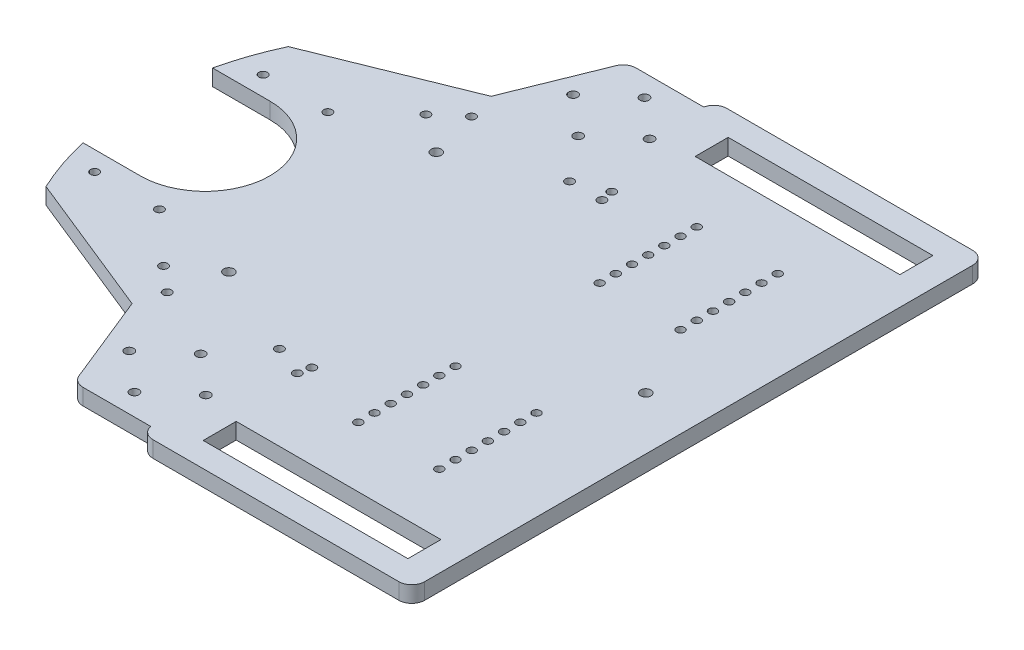
from build123d import *

# Parameters (mm, degrees)
BOSS_EXTRUDE1_DEPTH    = 6.35
SKETCH2_R              = 1.5875
SKETCH2_W              = 80.264
SKETCH2_H              = 12.954
CUT_EXTRUDE1_DEPTH     = 162.484606465
SKETCH7_R              = 2.032
CUT_EXTRUDE4_DEPTH     = 162.484606465
SKETCH8_R              = 1.651
CUT_EXTRUDE5_DEPTH     = 162.484606465
CUT_EXTRUDE6_DEPTH     = 160.416662013
SKETCH10_R             = 1.651
CUT_EXTRUDE7_DEPTH     = 160.416662013
SKETCH11_W             = 225
SKETCH11_H             = 6.35
BOSS_EXTRUDE2_DEPTH    = 8
FILLET2_R              = 5.08
SKETCH15_W             = 29.985408059
SKETCH15_H             = 4.069721463
CUT_EXTRUDE8_DEPTH     = 160.416662013
CUT_EXTRUDE9_START     = -6.35
CUT_EXTRUDE9_OUTLINE_R = 1.775
CUT_EXTRUDE9_DEPTH     = 6.35


# Read off the part's stored shape, not the designer's step: Cut-Extrude9
with BuildPart() as part:
    # Sketch1 → Boss-Extrude1 (new body)
    with BuildSketch(Plane(origin=(0, 0, 0), x_dir=(1, 0, 0), z_dir=(0, 1, 0))):
        with BuildLine():
            Line((-3.175, 112.5), (95.25, 112.5))
            Line((95.25, 112.5), (95.25, -112.5))
            Line((95.25, -112.5), (-3.175, -112.5))
            ThreePointArc((-3.175, -112.5), (-115.675, 0), (-3.175, 112.5))
        make_face()
    extrude(amount=-BOSS_EXTRUDE1_DEPTH)

    # Sketch2 → Cut-Extrude1 (cut, through all)
    with BuildSketch(Plane(origin=(0, 0, 0), x_dir=(1, 0, 0), z_dir=(0, 1, 0))):
        with Locations(Location((36.144045702, -66.3448, 0), (0, 0, 270))):
            Circle(SKETCH2_R)
        with Locations(Location((36.144045702, -59.9948, 0), (0, 0, 270))):
            Circle(SKETCH2_R)
        with Locations(Location((36.144045702, -53.6448, 0), (0, 0, 270))):
            Circle(SKETCH2_R)
        with Locations(Location((36.144045702, -47.2948, 0), (0, 0, 270))):
            Circle(SKETCH2_R)
        with Locations(Location((36.144045702, -40.9448, 0), (0, 0, 270))):
            Circle(SKETCH2_R)
        with Locations(Location((36.144045702, -34.5948, 0), (0, 0, 270))):
            Circle(SKETCH2_R)
        with Locations(Location((36.144045702, -28.2448, 0), (0, 0, 270))):
            Circle(SKETCH2_R)
        with Locations(Location((67.894045702, -66.3448, 0), (0, 0, 270))):
            Circle(SKETCH2_R)
        with Locations(Location((67.894045702, -59.9948, 0), (0, 0, 270))):
            Circle(SKETCH2_R)
        with Locations(Location((67.894045702, -53.6448, 0), (0, 0, 270))):
            Circle(SKETCH2_R)
        with Locations(Location((67.894045702, -47.2948, 0), (0, 0, 270))):
            Circle(SKETCH2_R)
        with Locations(Location((67.894045702, -40.9448, 0), (0, 0, 270))):
            Circle(SKETCH2_R)
        with Locations(Location((67.894045702, -34.5948, 0), (0, 0, 270))):
            Circle(SKETCH2_R)
        with Locations(Location((67.894045702, -28.2448, 0), (0, 0, 270))):
            Circle(SKETCH2_R)
        with Locations(Location((36.144045702, 66.3448, 0), (0, 0, 270))):
            Circle(SKETCH2_R)
        with Locations(Location((36.144045702, 59.9948, 0), (0, 0, 270))):
            Circle(SKETCH2_R)
        with Locations(Location((36.144045702, 53.6448, 0), (0, 0, 270))):
            Circle(SKETCH2_R)
        with Locations(Location((36.144045702, 47.2948, 0), (0, 0, 270))):
            Circle(SKETCH2_R)
        with Locations(Location((36.144045702, 40.9448, 0), (0, 0, 270))):
            Circle(SKETCH2_R)
        with Locations(Location((36.144045702, 34.5948, 0), (0, 0, 270))):
            Circle(SKETCH2_R)
        with Locations(Location((36.144045702, 28.2448, 0), (0, 0, 270))):
            Circle(SKETCH2_R)
        with Locations(Location((67.894045702, 66.3448, 0), (0, 0, 270))):
            Circle(SKETCH2_R)
        with Locations(Location((67.894045702, 59.9948, 0), (0, 0, 270))):
            Circle(SKETCH2_R)
        with Locations(Location((67.894045702, 53.6448, 0), (0, 0, 270))):
            Circle(SKETCH2_R)
        with Locations(Location((67.894045702, 47.2948, 0), (0, 0, 270))):
            Circle(SKETCH2_R)
        with Locations(Location((67.894045702, 40.9448, 0), (0, 0, 270))):
            Circle(SKETCH2_R)
        with Locations(Location((67.894045702, 34.5948, 0), (0, 0, 270))):
            Circle(SKETCH2_R)
        with Locations(Location((67.894045702, 28.2448, 0), (0, 0, 270))):
            Circle(SKETCH2_R)
        with Locations((52.019045702, -96.4438)):
            Rectangle(SKETCH2_W, SKETCH2_H)
        with Locations((52.019045702, 96.4438)):
            Rectangle(SKETCH2_W, SKETCH2_H)
    extrude(amount=-CUT_EXTRUDE1_DEPTH, mode=Mode.SUBTRACT)

    # Sketch7 → Cut-Extrude4 (cut, through all)
    with BuildSketch(Plane(origin=(0, 0, 0), x_dir=(1, 0, 0), z_dir=(0, 1, 0))):
        with Locations(Location((82.511862056, 0, 0), (0, 0, 270))):
            Circle(SKETCH7_R)
        with Locations(Location((-40.297137944, 40.64, 0), (0, 0, 270))):
            Circle(SKETCH7_R)
        with Locations(Location((-40.297137944, -40.64, 0), (0, 0, 270))):
            Circle(SKETCH7_R)
    extrude(amount=-CUT_EXTRUDE4_DEPTH, mode=Mode.SUBTRACT)

    # Sketch8 → Cut-Extrude5 (cut, through all)
    with BuildSketch(Plane(origin=(0, 0, 0), x_dir=(1, 0, 0), z_dir=(0, 1, 0))):
        with Locations(Location((-100.5586, 33.02, 0), (0, 0, 270))):
            Circle(SKETCH8_R)
        with Locations(Location((-100.5586, -33.02, 0), (0, 0, 270))):
            Circle(SKETCH8_R)
        with Locations(Location((-75.1586, 33.02, 0), (0, 0, 270))):
            Circle(SKETCH8_R)
        with Locations(Location((-75.1586, -33.02, 0), (0, 0, 270))):
            Circle(SKETCH8_R)
        with BuildLine():
            Line((-90.2716, 25.4), (-229.776686608, 25.4))
            Line((-229.776686608, 25.4), (-229.776686608, -25.4))
            Line((-229.776686608, -25.4), (-90.2716, -25.4))
            ThreePointArc((-90.2716, -25.4), (-64.8716, 0), (-90.2716, 25.4))
        make_face()
    extrude(amount=-CUT_EXTRUDE5_DEPTH, mode=Mode.SUBTRACT)

    # Sketch9 → Cut-Extrude6 (cut, through all)
    with BuildSketch(Plane(origin=(0, 0, 0), x_dir=(1, 0, 0), z_dir=(0, 1, 0))):
        Polygon((-105.15131959, 47.508738596), (-48.53191541, 70.384462776), (-12.279886537, 160.111382848), (-19.546794421, 160.111382848), (-135.640402248, 160.111382848), (-135.640402248, 47.508738596), align=None)
        Polygon((-105.15131959, -47.508738596), (-48.53191541, -70.384462776), (-12.279886537, -160.111382848), (-135.640402248, -160.111382848), (-135.640402248, -47.508738596), align=None)
    extrude(amount=-CUT_EXTRUDE6_DEPTH, mode=Mode.SUBTRACT)

    # Sketch10 → Cut-Extrude7 (cut, through all)
    with BuildSketch(Plane(origin=(0, 0, 0), x_dir=(1, 0, 0), z_dir=(0, 1, 0))):
        with Locations(Location((-55.150916162, 51.425007473, 0), (0, 0, 270))):
            Circle(SKETCH10_R)
        with Locations(Location((-45.493760399, 59.672997687, 0), (0, 0, 270))):
            Circle(SKETCH10_R)
        with Locations(Location((-4.266941588, 56.871109398, 0), (0, 0, 270))):
            Circle(SKETCH10_R)
        with Locations(Location((7.508293365, 61.628613135, 0), (0, 0, 270))):
            Circle(SKETCH10_R)
        with Locations(Location((8.433058412, -56.871109398, 0), (0, 0, 270))):
            Circle(SKETCH10_R)
        with Locations(Location((8.433058412, 56.871109398, 0), (0, 0, 270))):
            Circle(SKETCH10_R)
        with Locations(Location((-55.150916162, -51.425007473, 0), (0, 0, 270))):
            Circle(SKETCH10_R)
        with Locations(Location((-45.493760399, -59.672997687, 0), (0, 0, 270))):
            Circle(SKETCH10_R)
        with Locations(Location((-4.266941588, -56.871109398, 0), (0, 0, 270))):
            Circle(SKETCH10_R)
        with Locations(Location((7.508293365, -61.628613135, 0), (0, 0, 270))):
            Circle(SKETCH10_R)
    extrude(amount=-CUT_EXTRUDE7_DEPTH, mode=Mode.SUBTRACT)

    # Sketch11 → Boss-Extrude2 (add)
    with BuildSketch(Plane(origin=(95.25, 0, 0), x_dir=(0, 0, -1), z_dir=(1, 0, 0))):
        with Locations((0, -3.175)):
            Rectangle(SKETCH11_W, SKETCH11_H)
    extrude(amount=BOSS_EXTRUDE2_DEPTH)

    # Fillet2
    fillet2_edges = [part.edges().sort_by_distance(p)[0] for p in [
        (103.25, -3.175, -112.5),
        (103.25, -3.175, 112.5),
    ]]
    fillet(fillet2_edges, radius=FILLET2_R)

    # Sketch15 → Cut-Extrude8 (cut, through all)
    with BuildSketch(Plane(origin=(0, 0, 0), x_dir=(1, 0, 0), z_dir=(0, 1, 0))):
        with Locations((-18.16770403, -110.465139268)):
            Rectangle(SKETCH15_W, SKETCH15_H)
        with Locations((-18.16770403, 110.465139268)):
            Rectangle(SKETCH15_W, SKETCH15_H)
    extrude(amount=-CUT_EXTRUDE8_DEPTH, mode=Mode.SUBTRACT)

    # Cut-Extrude9 outline → Cut-Extrude9 (cut)
    with BuildSketch(Plane(origin=(0, 0, 0), x_dir=(1, 0, 0), z_dir=(0, 1, 0)).offset(CUT_EXTRUDE9_START)):
        with BuildLine():
            Line((-3.175, 112.5), (-3.175, 108.430278537))
            ThreePointArc((-3.175, 108.430278537), (-1.411607293, 111.353104052), (1.803527622, 112.5))
            Line((1.803527622, 112.5), (-3.175, 112.5))
        make_face()
        with BuildLine():
            ThreePointArc((-34.443998775, 105.253280031), (-32.574604743, 107.561789405), (-29.733904794, 108.430278537))
            Line((-29.733904794, 108.430278537), (-33.160408059, 108.430278537))
            Line((-33.160408059, 108.430278537), (-34.443998775, 105.253280031))
        make_face()
        with BuildLine():
            Line((-33.160408059, -108.430278537), (-29.733904794, -108.430278537))
            ThreePointArc((-29.733904794, -108.430278537), (-32.574604743, -107.561789405), (-34.443998775, -105.253280031))
            Line((-34.443998775, -105.253280031), (-33.160408059, -108.430278537))
        make_face()
        with BuildLine():
            ThreePointArc((1.803527622, -112.5), (-1.411607293, -111.353104052), (-3.175, -108.430278537))
            Line((-3.175, -108.430278537), (-3.175, -112.5))
            Line((-3.175, -112.5), (1.803527622, -112.5))
        make_face()
        with Locations((-33, -87)):
            Circle(CUT_EXTRUDE9_OUTLINE_R)
        with Locations((-18, -100)):
            Circle(CUT_EXTRUDE9_OUTLINE_R)
        with Locations((-18, -74)):
            Circle(CUT_EXTRUDE9_OUTLINE_R)
        with Locations((-3, -87)):
            Circle(CUT_EXTRUDE9_OUTLINE_R)
        with Locations((-33, 87)):
            Circle(CUT_EXTRUDE9_OUTLINE_R)
        with Locations((-18, 100)):
            Circle(CUT_EXTRUDE9_OUTLINE_R)
        with Locations((-18, 74)):
            Circle(CUT_EXTRUDE9_OUTLINE_R)
        with Locations((-3, 87)):
            Circle(CUT_EXTRUDE9_OUTLINE_R)
    extrude(amount=CUT_EXTRUDE9_DEPTH, mode=Mode.SUBTRACT)


solid = part.part
